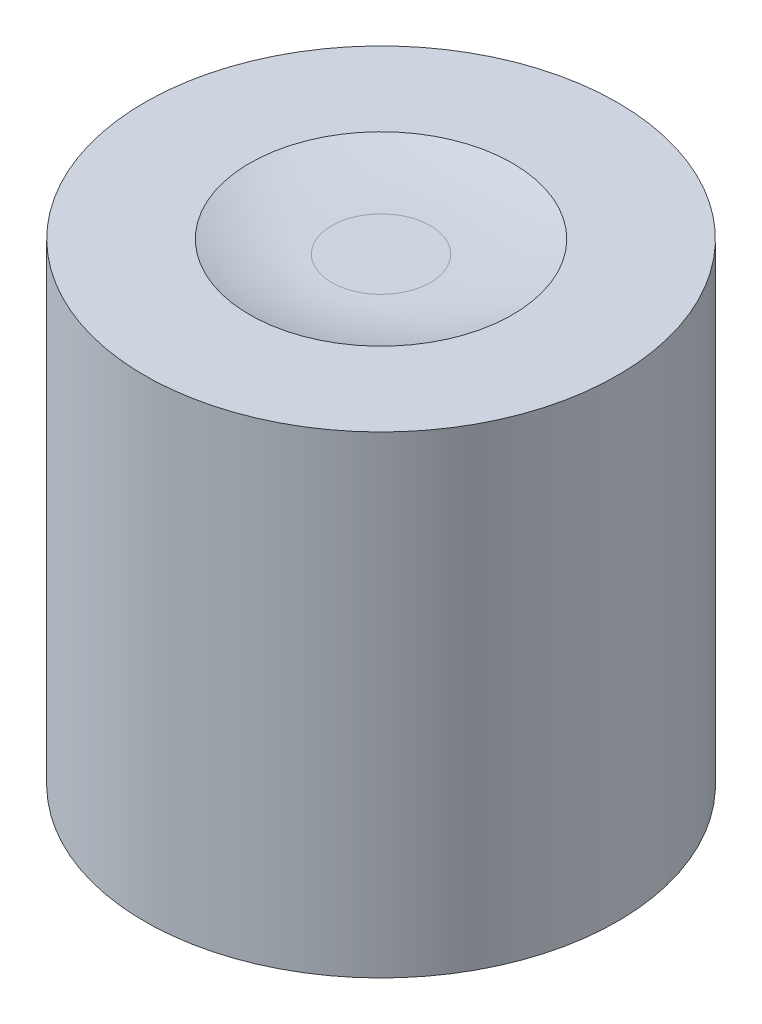
from build123d import *

# Parameters (mm, degrees)
SKETCH1_W           = 4.5
SKETCH1_H           = 9
BOSS_EXTRUDE1_DEPTH = 0.25
BOSS_EXTRUDE2_DEPTH = 0.25
SKETCH5_W           = 2
SKETCH5_H           = 6.25


with BuildPart() as part:
    # Sketch1 → Revolve1 (revolve)
    with BuildSketch(Plane.XY):
        with Locations((2.25, 4.5)):
            Rectangle(SKETCH1_W, SKETCH1_H)
    revolve(axis=Axis((0, 9, 0), (0, -1, 0)))

    # Sketch2 → Boss-Extrude1 (add)
    with BuildSketch(Plane.XZ):
        with BuildLine():
            Line((0.5, -3.464101615), (0.5, 3.464101615))
            ThreePointArc((0.5, 3.464101615), (3.5, 0), (0.5, -3.464101615))
        make_face()
    extrude(amount=BOSS_EXTRUDE1_DEPTH)

    # Sketch3 → Boss-Extrude2 (add)
    with BuildSketch(Plane.XZ):
        with BuildLine():
            Line((-0.5, 3.464101615), (-0.5, -3.464101615))
            ThreePointArc((-0.5, -3.464101615), (-3.5, 0), (-0.5, 3.464101615))
        make_face()
    extrude(amount=BOSS_EXTRUDE2_DEPTH)

    # Sketch4 → Cut-Revolve1 (revolve, cut)
    with BuildSketch(Plane.XY):
        with BuildLine():
            Line((2.5, 9), (0, 9))
            Line((0, 9), (0, 8.75))
            Line((0, 8.75), (0.9387505, 8.75))
            ThreePointArc((0.9387505, 8.75), (1.729319915, 8.812895585), (2.5, 9))
        make_face()
    revolve(axis=Axis((0, 9, 0), (0, -1, 0)), mode=Mode.SUBTRACT)

    # Sketch5 → Cut-Revolve2 (revolve, cut)
    with BuildSketch(Plane.XY):
        with Locations((1, 2.875)):
            Rectangle(SKETCH5_W, SKETCH5_H)
    revolve(axis=Axis((0, 6, 0), (0, -1, 0)), mode=Mode.SUBTRACT)


solid = part.part
